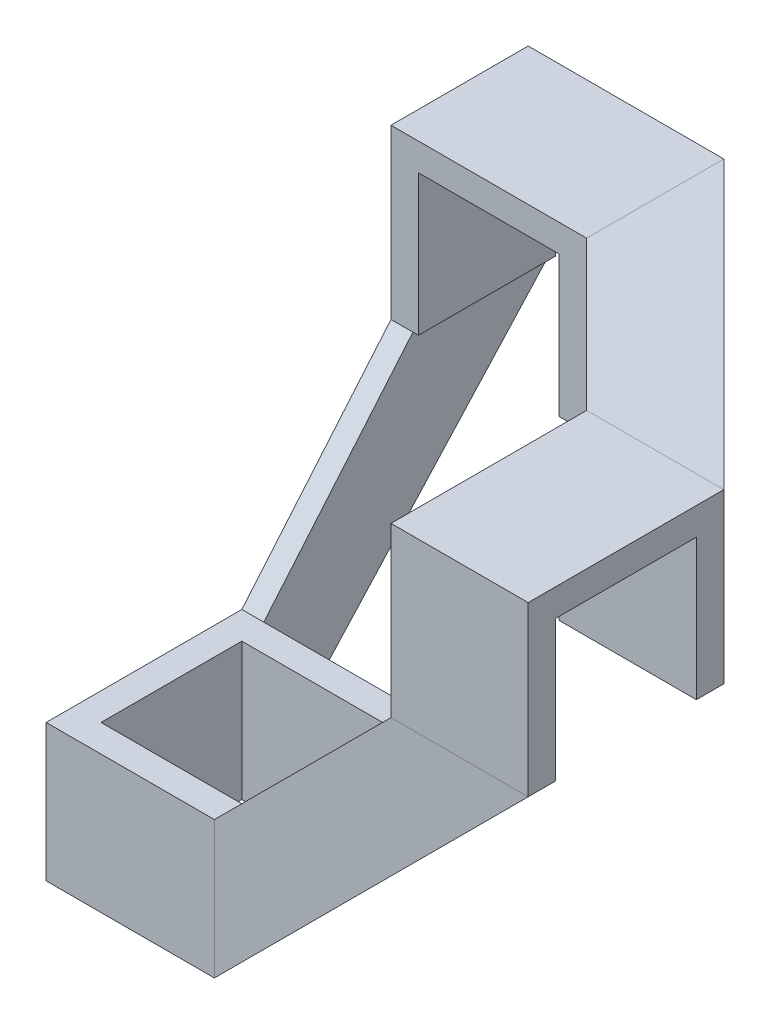
from build123d import *

# Parameters (mm, degrees)
C_START                                 = -12.825
C_CHANNEL_IGVC_5MM_CORNER_3_OUTLINE_W   = 52.175
C_CHANNEL_IGVC_5MM_CORNER_3_OUTLINE_H   = 5
C_CHANNEL_IGVC_5MM_CORNER_3_OUTLINE_W_2 = 57.175
C_CHANNEL_IGVC_5MM_CORNER_3_DEPTH       = 30.65
C_START_2                               = 12.825
C_CHANNEL_IGVC_5MM_CORNER_3_2_DEPTH     = 5
C_START_3                               = -70
C_CHANNEL_IGVC_5MM_CORNER_3_3_DEPTH     = 57.175
C_CHANNEL_IGVC_5MM_CORNER_3_4_OUTLINE_W = 5
C_CHANNEL_IGVC_5MM_CORNER_3_4_OUTLINE_H = 70
C_CHANNEL_IGVC_5MM_CORNER_3_4_DEPTH     = 30.65
C_CHANNEL_IGVC_5MM_CORNER_3_5_OUTLINE_W = 25.65
C_CHANNEL_IGVC_5MM_CORNER_3_5_OUTLINE_H = 70
C_CHANNEL_IGVC_5MM_CORNER_3_5_DEPTH     = 5
CUT_EXTRUDE1_DEPTH                      = 30
CUT_EXTRUDE1_DEPTH_BACK                 = 45
SKETCH16_W                              = 90
SKETCH16_H                              = 90
BOSS_EXTRUDE1_DEPTH                     = 4
BOSS_EXTRUDE2_DEPTH                     = 4
BOSS_EXTRUDE3_DEPTH                     = 4


# Read off the part's stored shape, not the designer's step: C channel IGVC_5MM_CORNER(3)
with BuildPart() as part:
    # C channel IGVC_5MM_CORNER(3) outline → C channel IGVC_5MM_CORNER(3) (new body)
    with BuildSketch(Plane(origin=(0, 0, 0), x_dir=(1, 0, 0), z_dir=(0, 1, 0)).offset(C_START)):
        with Locations((43.9125, 15.325)):
            Rectangle(C_CHANNEL_IGVC_5MM_CORNER_3_OUTLINE_W, C_CHANNEL_IGVC_5MM_CORNER_3_OUTLINE_H)
        with Locations((41.4125, -15.325)):
            Rectangle(C_CHANNEL_IGVC_5MM_CORNER_3_OUTLINE_W_2, C_CHANNEL_IGVC_5MM_CORNER_3_OUTLINE_H)
    extrude(amount=C_CHANNEL_IGVC_5MM_CORNER_3_DEPTH)

    # C channel IGVC_5MM_CORNER_3 2 outline → C channel IGVC_5MM_CORNER_3 2 (add)
    with BuildSketch(Plane(origin=(0, 0, 0), x_dir=(1, 0, 0), z_dir=(0, 1, 0)).offset(C_START_2)):
        Polygon((70, -12.825), (70, 12.825), (17.825, 12.825), (17.825, 0), (-12.825, 0), (-12.825, -12.825), align=None)
    extrude(amount=C_CHANNEL_IGVC_5MM_CORNER_3_2_DEPTH)


with BuildPart() as body_2:
    # C channel IGVC_5MM_CORNER_3 3 outline → C channel IGVC_5MM_CORNER_3 3 (new body)
    with BuildSketch(Plane(origin=(0, 0, 0), x_dir=(1, 0, 0), z_dir=(0, 1, 0)).offset(C_START_3)):
        Polygon((-17.825, -17.825), (12.825, -17.825), (12.825, -12.825), (-12.825, -12.825), (-12.825, 12.825), (12.825, 12.825), (12.825, 17.825), (-17.825, 17.825), align=None)
    extrude(amount=C_CHANNEL_IGVC_5MM_CORNER_3_3_DEPTH)


with BuildPart() as body_3:
    # C channel IGVC_5MM_CORNER_3 4 outline → C channel IGVC_5MM_CORNER_3 4 (new body)
    with BuildSketch(Plane(origin=(0, 0, 0), x_dir=(1, 0, 0), z_dir=(0, 1, 0)).offset(C_START)):
        with Locations((-15.325, 35)):
            Rectangle(C_CHANNEL_IGVC_5MM_CORNER_3_4_OUTLINE_W, C_CHANNEL_IGVC_5MM_CORNER_3_4_OUTLINE_H)
        with Locations((15.325, 35)):
            Rectangle(C_CHANNEL_IGVC_5MM_CORNER_3_4_OUTLINE_W, C_CHANNEL_IGVC_5MM_CORNER_3_4_OUTLINE_H)
    extrude(amount=C_CHANNEL_IGVC_5MM_CORNER_3_4_DEPTH)

    # C channel IGVC_5MM_CORNER_3 5 outline → C channel IGVC_5MM_CORNER_3 5 (add)
    with BuildSketch(Plane(origin=(0, 0, 0), x_dir=(1, 0, 0), z_dir=(0, 1, 0)).offset(C_START_2)):
        with Locations((0, 35)):
            Rectangle(C_CHANNEL_IGVC_5MM_CORNER_3_5_OUTLINE_W, C_CHANNEL_IGVC_5MM_CORNER_3_5_OUTLINE_H)
    extrude(amount=C_CHANNEL_IGVC_5MM_CORNER_3_5_DEPTH)


with BuildPart() as cut_extrude1_tool:
    # Sketch16 → Cut-Extrude1 (new, two sides: drawn at the far end of the back side and taken through both)
    with BuildSketch(Plane.XY.offset(-CUT_EXTRUDE1_DEPTH_BACK)):
        Rectangle(SKETCH16_W, SKETCH16_H)
    extrude(amount=CUT_EXTRUDE1_DEPTH + CUT_EXTRUDE1_DEPTH_BACK)


with BuildPart() as part_1:
    add(part.part)

    # Cut-Extrude1: cut by cut_extrude1_tool
    add(cut_extrude1_tool.part, mode=Mode.SUBTRACT)


with BuildPart() as body_2_1:
    add(body_2.part)

    # Cut-Extrude1: cut by cut_extrude1_tool
    add(cut_extrude1_tool.part, mode=Mode.SUBTRACT)


with BuildPart() as body_3_1:
    add(body_3.part)

    # Cut-Extrude1: cut by cut_extrude1_tool
    add(cut_extrude1_tool.part, mode=Mode.SUBTRACT)


with BuildPart() as body_4:
    # Sketch22 → Boss-Extrude1 (new body)
    with BuildSketch(Plane(origin=(0, 17.825, 0), x_dir=(1, 0, 0), z_dir=(0, 1, 0))):
        Polygon((17.825, 45), (45, 17.825), (70, 17.825), (17.825, 70), align=None)
    extrude(amount=-BOSS_EXTRUDE1_DEPTH)


with BuildPart() as body_5:
    # Sketch21 → Boss-Extrude2 (new body)
    with BuildSketch(Plane.ZY.offset(17.825)):
        Polygon((-17.825, -45), (-45, -12.825), (-70, -12.825), (-17.825, -70), align=None)
    extrude(amount=-BOSS_EXTRUDE2_DEPTH)


with BuildPart() as body_6:
    # Sketch20 → Boss-Extrude3 (new body)
    with BuildSketch(Plane.XY.offset(17.825)):
        Polygon((12.825, -45), (45, -12.825), (70, -12.825), (12.825, -70), align=None)
    extrude(amount=-BOSS_EXTRUDE3_DEPTH)


solid = Compound([part_1.part, body_2_1.part, body_3_1.part, body_4.part, body_5.part, body_6.part])
